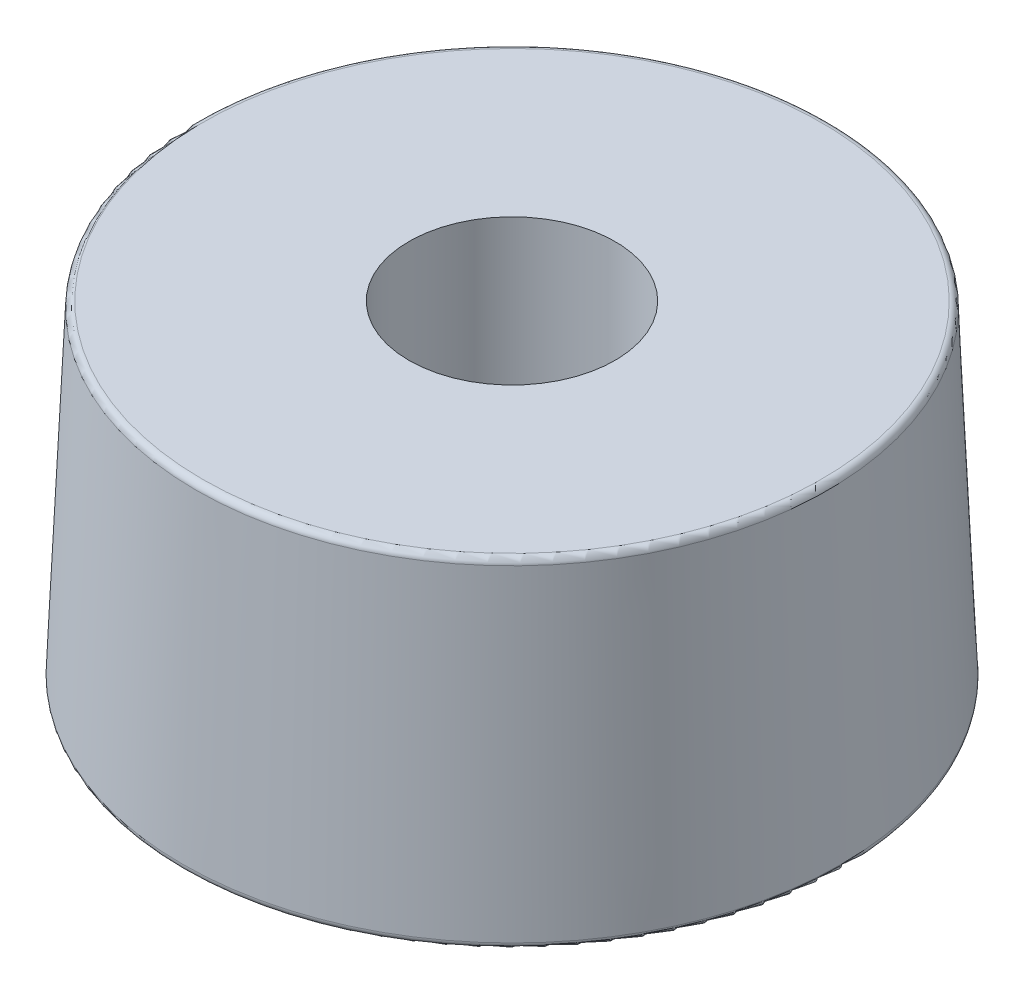
from build123d import *

# Parameters (mm, degrees)
SKETCH1_R           = 25.4
SKETCH1_R_2         = 7.9375
BOSS_EXTRUDE1_DEPTH = 12.7
CHAMFER1_SIZE       = 25.4
CHAMFER1_SIZE_2     = 1.10898795
FILLET1_R           = 0.5


with BuildPart() as part:
    # Sketch1 → Boss-Extrude1 (new, symmetric)
    with BuildSketch(Plane(origin=(0, 0, 0), x_dir=(1, 0, 0), z_dir=(0, 1, 0))):
        with Locations(Location((0, 0, 0), (0, 0, 270))):
            Circle(SKETCH1_R)
        with Locations(Location((0, 0, 0), (0, 0, 270))):
            Circle(SKETCH1_R_2, mode=Mode.SUBTRACT)
    extrude(amount=BOSS_EXTRUDE1_DEPTH, both=True)

    # Chamfer1
    # the kernel refuses this chamfer: 25.4, 1.10898795 mm, written as the material it takes off along each edge
    with BuildSketch(Plane(origin=(0, 12.7, 0), x_dir=(0, 0, 1), z_dir=(-1, 0, 0))) as chamfer1_piece_1:
        Polygon((25.4, -CHAMFER1_SIZE), (25.4 - CHAMFER1_SIZE_2, 0), (25.4, 0), align=None)
    revolve(axis=Axis((0, 12.7, 0), (0, 1, 0)), mode=Mode.SUBTRACT)

    # Fillet1
    fillet1_edges = [part.edges().sort_by_distance(p)[0] for p in [
        (0, -12.7, -25.4),
        (0, 12.7, -24.29101205),
    ]]
    fillet(fillet1_edges, radius=FILLET1_R)


solid = part.part
